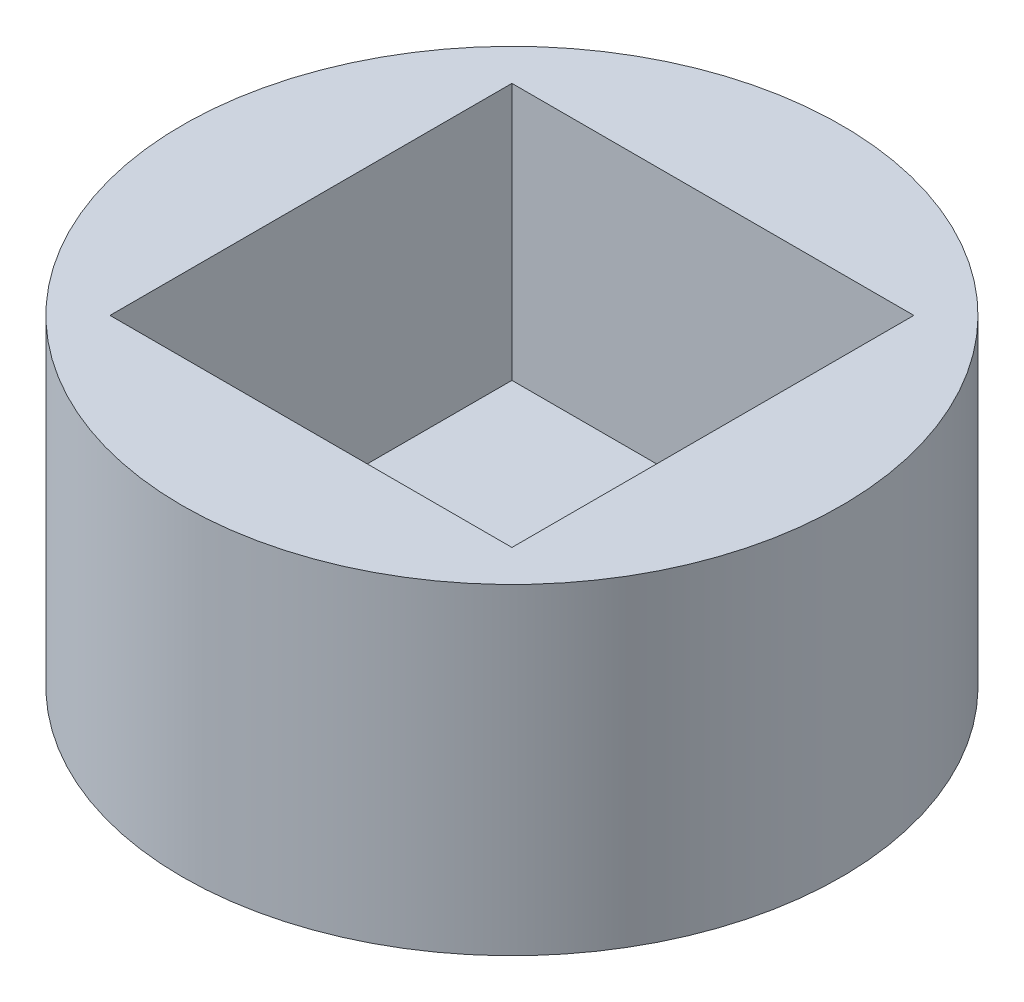
from build123d import *

# Parameters (mm, degrees)
SKETCH1_R           = 26.035
BOSS_EXTRUDE1_DEPTH = 25.4
SKETCH2_W           = 31.75
SKETCH2_H           = 31.75
CUT_EXTRUDE1_DEPTH  = 20.32


with BuildPart() as part:
    # Sketch1 → Boss-Extrude1 (new body)
    with BuildSketch(Plane(origin=(0, 0, 0), x_dir=(1, 0, 0), z_dir=(0, 1, 0))):
        Circle(SKETCH1_R)
    extrude(amount=BOSS_EXTRUDE1_DEPTH)

    # Sketch2 → Cut-Extrude1 (cut)
    with BuildSketch(Plane(origin=(0, 25.4, 0), x_dir=(1, 0, 0), z_dir=(0, 1, 0))):
        Rectangle(SKETCH2_W, SKETCH2_H)
    extrude(amount=-CUT_EXTRUDE1_DEPTH, mode=Mode.SUBTRACT)


solid = part.part
